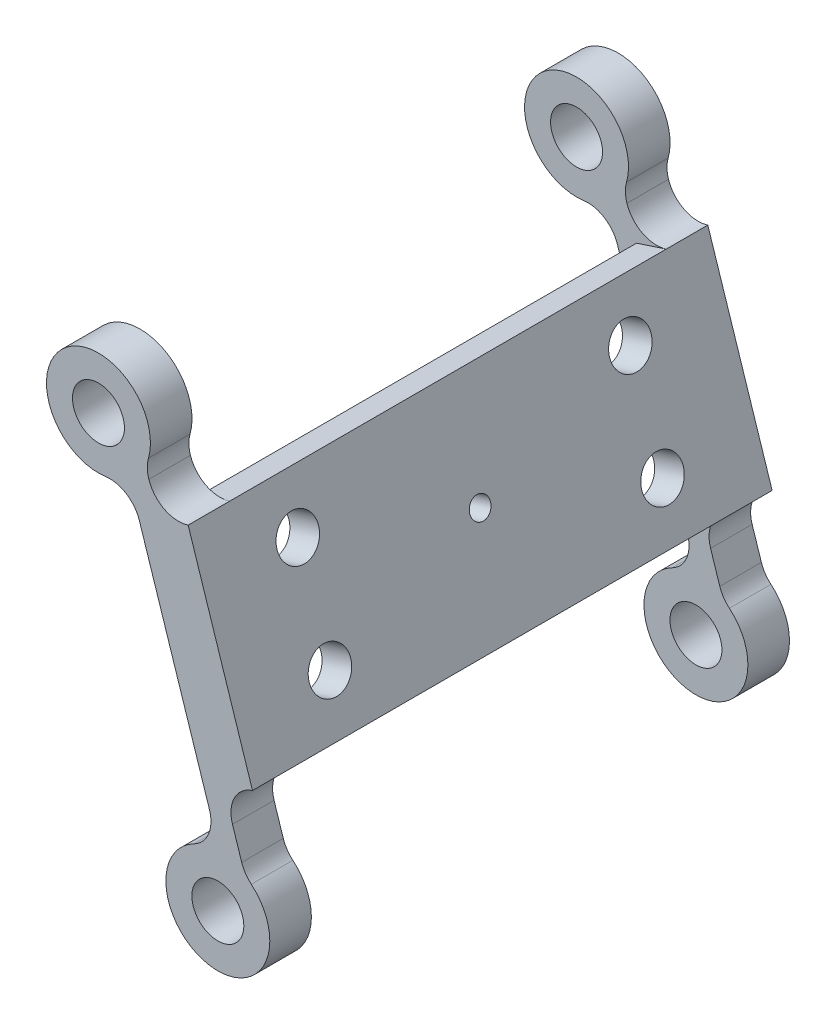
from build123d import *

# Parameters (mm, degrees)
SKETCH1_R           = 2.5
BOSS_EXTRUDE1_DEPTH = 4
BOSS_EXTRUDE2_DEPTH = 50
SKETCH3_R           = 2
SKETCH3_R_2         = 1
CUT_EXTRUDE1_DEPTH  = 10
FILLET1_R           = 3


with BuildPart() as part:
    # Sketch1 → Boss-Extrude1 (new body)
    with BuildSketch(Plane.XY):
        with BuildLine():
            Line((-7.842362425, 10.716234493), (-17.397624454, 40.071064625))
            ThreePointArc((-17.397624454, 40.071064625), (-25.795005306, 45.357497095), (-18.956793202, 38.167140452))
            Line((-18.956793202, 38.167140452), (-18.754238897, 37.544871045))
            Line((-18.754238897, 37.544871045), (-10.63810017, 12.611188123))
            Line((-10.63810017, 12.611188123), (-10.256851829, 11.439950722))
            ThreePointArc((-10.256851829, 11.439950722), (-11.874437039, 1.653788416), (-7.842362425, 10.716234493))
        make_face()
        with Locations((-10.438845238, 6.44326398)):
            Circle(SKETCH1_R, mode=Mode.SUBTRACT)
        with Locations((-21.926625837, 42.189589224)):
            Circle(SKETCH1_R, mode=Mode.SUBTRACT)
    boss_extrude1 = extrude(amount=BOSS_EXTRUDE1_DEPTH)

    # Sketch2 → Boss-Extrude2 (add)
    with BuildSketch(Plane.XY.offset(4)):
        Polygon((-16.14843876, 36.233426921), (-9.957962302, 17.215593153), (-7.105287237, 18.144164622), (-13.295763695, 37.161998389), align=None)
    extrude(amount=-BOSS_EXTRUDE2_DEPTH)

    # Mirror1: Boss-Extrude1 across plane
    add(boss_extrude1.mirror(Plane.XY.offset(-21)))

    # Sketch3 → Cut-Extrude1 (cut)
    with BuildSketch(Plane(origin=(-3.936983875, -1.281523768, 0), x_dir=(0, 0, 1), z_dir=(-0.950891688393093, -0.30952382290371966, 0))):
        with Locations(Location((-5, 34.452391, 0), (0, 0, 270))):
            Circle(SKETCH3_R)
        with Locations(Location((-5, 24.452391, 0), (0, 0, 90))):
            Circle(SKETCH3_R)
        with Locations(Location((-37, 24.452391, 0), (0, 0, 270))):
            Circle(SKETCH3_R)
        with Locations(Location((-37, 34.452391, 0), (0, 0, 90))):
            Circle(SKETCH3_R)
        with Locations(Location((-21, 29.452391, 0), (0, 0, 270))):
            Circle(SKETCH3_R_2)
    extrude(amount=-CUT_EXTRUDE1_DEPTH, mode=Mode.SUBTRACT)

    # Fillet1
    fillet1_edges = [part.edges().sort_by_distance(p)[0] for p in [
        (-9.957962302, 17.215593153, 2),
        (-9.957962302, 17.215593153, -44),
        (-16.14843876, 36.233426921, -44),
        (-16.14843876, 36.233426921, 2),
        (-10.256851829, 11.439950722, 2),
        (-7.842362425, 10.716234493, 2),
        (-7.842362425, 10.716234493, -44),
        (-10.256851829, 11.439950722, -44),
        (-17.397624454, 40.071064625, -44),
        (-18.956793202, 38.167140452, -44),
        (-17.397624454, 40.071064625, 2),
        (-18.956793202, 38.167140452, 2),
    ]]
    fillet(fillet1_edges, radius=FILLET1_R - 0.0001)  # a hair under: the kernel refuses the full size


solid = part.part
